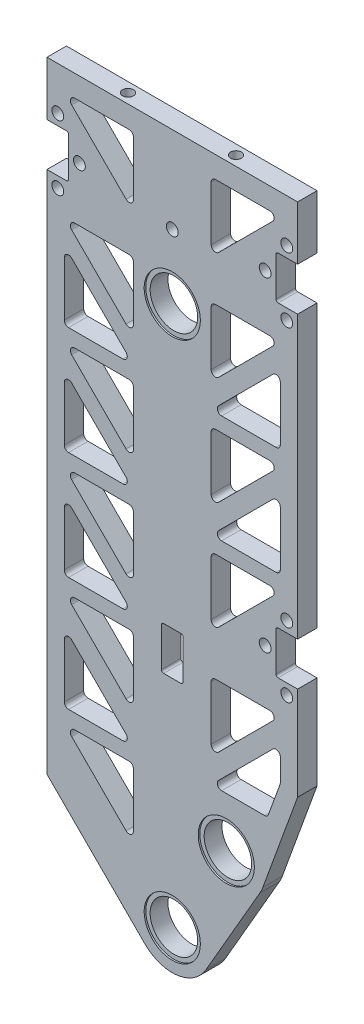
from build123d import *
from build123d.topology import SkipClean

# Parameters (mm, degrees)
SKETCH_1_R                   = 11
EXTRUDE_566_DEPTH            = 100
EXTRUDE_START                = -100
SKETCH_2_R                   = 11
EXTRUDE_875_DEPTH            = 100
EXTRUDE_2691_DEPTH           = 100
CUT_EXTRUDE_4148_DEPTH       = 534.010318849
CUT_EXTRUDE_4148_DEPTH_BACK  = 534.010318849
SKETCH_3_W                   = 90
SKETCH_3_H                   = 380
SKETCH_5_R                   = 2.5
EXTRUDE_4714_DEPTH           = 100
SKETCH_6_W                   = 191.177045066
SKETCH_6_H                   = 235.084722287
CUT_EXTRUDE_5028_DEPTH       = 84
SKETCH_7_R                   = 75
EXTRUDE_5316_DEPTH           = 5
CUT_EXTRUDE_6098_DEPTH       = 357.195171219
CUT_EXTRUDE_6098_DEPTH_BACK  = 357.195171219
FILLET_2_R                   = 2
MIRROR_START                 = 95
MIRROR_1_DEPTH               = 5
CUT_EXTRUDE_11151_DEPTH      = 357.195171219
CUT_EXTRUDE_11151_DEPTH_BACK = 357.195171219
SKETCH_12_W                  = 10
SKETCH_12_H                  = 20
FILLET_3_R                   = 1
CUT_EXTRUDE_START            = -5
CUT_EXTRUDE_12032_OUTLINE_R  = 5
CUT_EXTRUDE_12032_DEPTH      = 5
CUT_EXTRUDE_7_DEPTH          = 357.195171219
CUT_EXTRUDE_7_DEPTH_BACK     = 357.195171219
SKETCH_14_W                  = 10
SKETCH_14_H                  = 20
FILLET_4_R                   = 1
CUT_EXTRUDE_START_2          = -129
SKETCH_15_R                  = 11
CUT_EXTRUDE_8_DEPTH          = 129
SKETCH_16_R                  = 13
CUT_EXTRUDE_9_DEPTH          = 0.75
CUT_EXTRUDE_START_3          = -0.75
SKETCH_17_R                  = 13
CUT_EXTRUDE_10_DEPTH         = 0.75
SKETCH_18_R                  = 11
CUT_EXTRUDE_11_DEPTH         = 113
CUT_EXTRUDE_12_DEPTH         = 357.195171219
CUT_EXTRUDE_12_DEPTH_BACK    = 357.195171219
MOVE_FACE_1_BY               = 4
SKETCH_21_R                  = 2.5
CUT_EXTRUDE_13_DEPTH         = 17
CUT_EXTRUDE_15_DEPTH         = 326.338285481
CUT_EXTRUDE_15_DEPTH_BACK    = 326.338285481
SKETCH_23_R                  = 2.75
SKETCH_24_R                  = 13
CUT_EXTRUDE_16_DEPTH         = 0.75
SKETCH_25_R                  = 2.75
CUT_EXTRUDE_17_DEPTH         = 10


# Read off the part's stored shape, not the designer's step: 镜向1, 电机安装轴承孔
with BuildPart() as part:
    # 草图1 → Extrude 566 (new body)
    with BuildSketch(Plane.XY):
        with BuildLine():
            Line((-18, 500), (-18, 0))
            ThreePointArc((-18, 0), (0, -18), (18, 0))
            Line((18, 0), (18, 500))
            ThreePointArc((18, 500), (0, 518), (-18, 500))
        make_face()
        with Locations((0, 500)):
            Circle(SKETCH_1_R, mode=Mode.SUBTRACT)
        Circle(SKETCH_1_R, mode=Mode.SUBTRACT)
    extrude(amount=EXTRUDE_566_DEPTH)

    # 草图2 → Extrude 875 (add)
    with BuildSketch(Plane.XY.offset(100).offset(EXTRUDE_START)):
        with BuildLine():
            Line((18, 61.301270189), (25, 61.301270189))
            ThreePointArc((25, 61.301270189), (40.588457268, 52.301270189), (40.588457268, 34.301270189))
            Line((40.588457268, 34.301270189), (15.588457268, -9))
            ThreePointArc((15.588457268, -9), (-4.658742812, -17.386664873), (-18, 0))
            Line((-18, 0), (-18, 61.301270189))
            Line((-18, 61.301270189), (18, 61.301270189))
        make_face()
        with Locations((25, 43.301270189)):
            Circle(SKETCH_2_R, mode=Mode.SUBTRACT)
        Circle(SKETCH_2_R, mode=Mode.SUBTRACT)
    extrude(amount=EXTRUDE_875_DEPTH)

    # 草图10 → Extrude 2691 (add)
    with BuildSketch(Plane(origin=(0, 0, 0), x_dir=(-1, 0, 0), z_dir=(0, 0, -1))):
        with BuildLine():
            Line((-41.914467174, 37.144907609), (-58, 81.339545828))
            Line((-58, 81.339545828), (-58, 320))
            Line((-58, 320), (-18, 320))
            Line((-18, 320), (-18, 61.301270189))
            Line((-18, 61.301270189), (-25, 61.301270189))
            ThreePointArc((-25, 61.301270189), (-39.744736797, 53.625646044), (-41.914467174, 37.144907609))
        make_face()
        with BuildLine():
            Line((12.727922061, -12.727922061), (58, 32.544155877))
            Line((58, 32.544155877), (58, 320))
            Line((58, 320), (18, 320))
            Line((18, 320), (18, 0))
            ThreePointArc((18, 0), (16.629831585, -6.888301783), (12.727922061, -12.727922061))
        make_face()
    extrude(amount=-EXTRUDE_2691_DEPTH)

    # 草图3 → Cut-Extrude 4148 (cut, two sides: drawn at the far end of the back side and taken through both)
    with BuildSketch(Plane.ZY.offset(18).offset(-CUT_EXTRUDE_4148_DEPTH_BACK)):
        with Locations((50, 150)):
            Rectangle(SKETCH_3_W, SKETCH_3_H)
    extrude(amount=CUT_EXTRUDE_4148_DEPTH + CUT_EXTRUDE_4148_DEPTH_BACK, mode=Mode.SUBTRACT)

    # 草图5 → Extrude 4714 (add)
    with BuildSketch(Plane.XY.offset(100)):
        with Locations(Location((0, 250, 0), (0, 0, 90))):
            Circle(SKETCH_5_R)
    extrude(amount=-EXTRUDE_4714_DEPTH)

    # 草图6 → Cut-Extrude 5028 (cut)
    with BuildSketch(Plane(origin=(18, 0, 0), x_dir=(0, 0, -1), z_dir=(1, 0, 0))):
        with Locations((-50.962374235, 437.542361144)):
            Rectangle(SKETCH_6_W, SKETCH_6_H)
    extrude(amount=-CUT_EXTRUDE_5028_DEPTH, mode=Mode.SUBTRACT)

    # 草图7 → Extrude 5316 (add)
    with BuildSketch(Plane(origin=(0, 320, 0), x_dir=(1, 0, 0), z_dir=(0, 1, 0))):
        with Locations(Location((0, -50, 0), (0, 0, 320.654170234))):
            Circle(SKETCH_7_R)
    extrude(amount=EXTRUDE_5316_DEPTH)

    # 草图10<3> → Cut-Extrude 6098 (cut, two sides: drawn at the far end of the back side and taken through both)
    with BuildSketch(Plane(origin=(0, 0, 0), x_dir=(-1, 0, 0), z_dir=(0, 0, -1)).offset(-CUT_EXTRUDE_6098_DEPTH_BACK)):
        Polygon((50, 310), (18, 310), (18, 278), align=None)
        Polygon((-18, 278), (-18, 310), (-50, 310), align=None)
        Polygon((-18, 227.925713543), (-18, 259.925713543), (-50, 259.925713543), align=None)
        Polygon((50, 259.925713543), (18, 259.925713543), (18, 227.925713543), align=None)
        Polygon((50, 248.612005044), (50, 216.612005044), (18, 216.612005044), align=None)
        Polygon((-50, 248.612005044), (-50, 216.612005044), (-18, 216.612005044), align=None)
        Polygon((-18, 177.851427085), (-18, 209.851427085), (-50, 209.851427085), align=None)
        Polygon((50, 209.851427085), (18, 209.851427085), (18, 177.851427085), align=None)
        Polygon((50, 198.537718586), (50, 166.537718586), (18, 166.537718586), align=None)
        Polygon((-50, 198.537718586), (-50, 166.537718586), (-18, 166.537718586), align=None)
        Polygon((-50, 159.777140628), (-18, 127.777140628), (-18, 159.777140628), align=None)
        Polygon((18, 159.777140628), (18, 127.777140628), (50, 159.777140628), align=None)
        Polygon((-50, 109.702854171), (-18, 77.702854171), (-18, 109.702854171), align=None)
        Polygon((18, 109.702854171), (18, 77.702854171), (50, 109.702854171), align=None)
        Polygon((-50, 98.389145672), (-50, 82.750161674), (-44.045077173, 66.389145672), (-18, 66.389145672), align=None)
        Polygon((18, 56.800140588), (18, 24.800140588), (50, 56.800140588), align=None)
        Polygon((50, 95.560718547), (50, 63.560718547), (18, 63.560718547), align=None)
        Polygon((50, 116.463432129), (18, 116.463432129), (50, 148.463432129), align=None)
    extrude(amount=CUT_EXTRUDE_6098_DEPTH + CUT_EXTRUDE_6098_DEPTH_BACK, mode=Mode.SUBTRACT)

    # 圆角2
    fillet_2_edges = [part.edges().sort_by_distance(p)[0] for p in [
        (50, 109.702854171, 2.5),
        (18, 109.702854171, 2.5),
        (18, 77.702854171, 2.5),
        (-18, 159.777140628, 2.5),
        (-50, 159.777140628, 2.5),
        (-18, 127.777140628, 2.5),
        (50, 159.777140628, 2.5),
        (18, 159.777140628, 2.5),
        (18, 127.777140628, 2.5),
        (50, 166.537718586, 2.5),
        (50, 198.537718586, 2.5),
        (18, 166.537718586, 2.5),
        (-50, 63.560718547, 2.5),
        (-18, 63.560718547, 2.5),
        (-50, 95.560718547, 2.5),
        (-50, 56.800140588, 2.5),
        (-18, 24.800140588, 2.5),
        (-18, 56.800140588, 2.5),
        (50, 82.750161674, 2.5),
        (50, 98.389145672, 2.5),
        (18, 66.389145672, 2.5),
        (44.045077173, 66.389145672, 2.5),
        (-18, 109.702854171, 2.5),
        (-50, 109.702854171, 2.5),
        (-18, 77.702854171, 2.5),
        (50, 310, 2.5),
        (18, 310, 2.5),
        (18, 278, 2.5),
        (50, 259.925713543, 2.5),
        (18, 259.925713543, 2.5),
        (18, 227.925713543, 2.5),
        (-50, 248.612005044, 2.5),
        (-50, 216.612005044, 2.5),
        (-18, 216.612005044, 2.5),
        (-18, 259.925713543, 2.5),
        (-50, 259.925713543, 2.5),
        (-18, 227.925713543, 2.5),
        (50, 216.612005044, 2.5),
        (50, 248.612005044, 2.5),
        (18, 216.612005044, 2.5),
        (50, 209.851427085, 2.5),
        (18, 209.851427085, 2.5),
        (18, 177.851427085, 2.5),
        (-50, 198.537718586, 2.5),
        (-50, 166.537718586, 2.5),
        (-18, 166.537718586, 2.5),
        (-18, 209.851427085, 2.5),
        (-50, 209.851427085, 2.5),
        (-18, 177.851427085, 2.5),
        (-50, 148.463432129, 2.5),
        (-50, 116.463432129, 2.5),
        (-18, 116.463432129, 2.5),
        (-18, 310, 2.5),
        (-50, 310, 2.5),
        (-18, 278, 2.5),
    ]]
    fillet(fillet_2_edges, radius=FILLET_2_R)

    # 镜向1 outline → 镜向1 (add)
    with BuildSketch(Plane.XY.offset(MIRROR_START)):
        with BuildLine():
            ThreePointArc((-50, 143.635005004), (-48.765366865, 145.482764069), (-46.585786438, 145.049218567))
            Line((-46.585786438, 145.049218567), (-50, 148.463432129))
            Line((-50, 148.463432129), (-50, 143.635005004))
        make_face()
        with BuildLine():
            Line((-18, 116.463432129), (-21.414213562, 119.877645691))
            ThreePointArc((-21.414213562, 119.877645691), (-20.98066806, 117.698065264), (-22.828427125, 116.463432129))
            Line((-22.828427125, 116.463432129), (-18, 116.463432129))
        make_face()
        with BuildLine():
            ThreePointArc((-48, 116.463432129), (-49.414213562, 117.049218567), (-50, 118.463432129))
            Line((-50, 118.463432129), (-50, 116.463432129))
            Line((-50, 116.463432129), (-48, 116.463432129))
        make_face()
        with BuildLine():
            ThreePointArc((-20, 310), (-18.585786438, 309.414213562), (-18, 308))
            Line((-18, 308), (-18, 310))
            Line((-18, 310), (-20, 310))
        make_face()
        with BuildLine():
            Line((-18, 278), (-18, 282.828427125))
            ThreePointArc((-18, 282.828427125), (-19.234633135, 280.98066806), (-21.414213562, 281.414213562))
            Line((-21.414213562, 281.414213562), (-18, 278))
        make_face()
        with BuildLine():
            ThreePointArc((-46.585786438, 306.585786438), (-47.01933194, 308.765366865), (-45.171572875, 310))
            Line((-45.171572875, 310), (-50, 310))
            Line((-50, 310), (-46.585786438, 306.585786438))
        make_face()
        with BuildLine():
            ThreePointArc((-20, 259.925713543), (-18.585786438, 259.339927105), (-18, 257.925713543))
            Line((-18, 257.925713543), (-18, 259.925713543))
            Line((-18, 259.925713543), (-20, 259.925713543))
        make_face()
        with BuildLine():
            Line((-18, 227.925713543), (-18, 232.754140667))
            ThreePointArc((-18, 232.754140667), (-19.234633135, 230.906381602), (-21.414213562, 231.339927105))
            Line((-21.414213562, 231.339927105), (-18, 227.925713543))
        make_face()
        with BuildLine():
            ThreePointArc((-46.585786438, 256.51149998), (-47.01933194, 258.691080407), (-45.171572875, 259.925713543))
            Line((-45.171572875, 259.925713543), (-50, 259.925713543))
            Line((-50, 259.925713543), (-46.585786438, 256.51149998))
        make_face()
        with BuildLine():
            ThreePointArc((-50, 243.783577919), (-48.765366865, 245.631336984), (-46.585786438, 245.197791481))
            Line((-46.585786438, 245.197791481), (-50, 248.612005044))
            Line((-50, 248.612005044), (-50, 243.783577919))
        make_face()
        with BuildLine():
            Line((-18, 216.612005044), (-21.414213562, 220.026218606))
            ThreePointArc((-21.414213562, 220.026218606), (-20.98066806, 217.846638179), (-22.828427125, 216.612005044))
            Line((-22.828427125, 216.612005044), (-18, 216.612005044))
        make_face()
        with BuildLine():
            ThreePointArc((-48, 216.612005044), (-49.414213563, 217.197791481), (-50, 218.612005044))
            Line((-50, 218.612005044), (-50, 216.612005044))
            Line((-50, 216.612005044), (-48, 216.612005044))
        make_face()
        with BuildLine():
            ThreePointArc((-20, 209.851427085), (-18.585786438, 209.265640647), (-18, 207.851427085))
            Line((-18, 207.851427085), (-18, 209.851427085))
            Line((-18, 209.851427085), (-20, 209.851427085))
        make_face()
        with BuildLine():
            Line((-18, 177.851427085), (-18, 182.67985421))
            ThreePointArc((-18, 182.67985421), (-19.234633135, 180.832095145), (-21.414213562, 181.265640648))
            Line((-21.414213562, 181.265640648), (-18, 177.851427085))
        make_face()
        with BuildLine():
            ThreePointArc((-46.585786438, 206.437213523), (-47.01933194, 208.61679395), (-45.171572875, 209.851427085))
            Line((-45.171572875, 209.851427085), (-50, 209.851427085))
            Line((-50, 209.851427085), (-46.585786438, 206.437213523))
        make_face()
        with BuildLine():
            ThreePointArc((-50, 193.709291462), (-48.765366865, 195.557050527), (-46.585786438, 195.123505024))
            Line((-46.585786438, 195.123505024), (-50, 198.537718586))
            Line((-50, 198.537718586), (-50, 193.709291462))
        make_face()
        with BuildLine():
            Line((-18, 166.537718586), (-21.414213562, 169.951932149))
            ThreePointArc((-21.414213562, 169.951932149), (-20.98066806, 167.772351722), (-22.828427125, 166.537718586))
            Line((-22.828427125, 166.537718586), (-18, 166.537718586))
        make_face()
        with BuildLine():
            ThreePointArc((-48, 166.537718586), (-49.414213562, 167.123505024), (-50, 168.537718586))
            Line((-50, 168.537718586), (-50, 166.537718586))
            Line((-50, 166.537718586), (-48, 166.537718586))
        make_face()
        with BuildLine():
            ThreePointArc((-20, 159.777140628), (-18.585786438, 159.19135419), (-18, 157.777140628))
            Line((-18, 157.777140628), (-18, 159.777140628))
            Line((-18, 159.777140628), (-20, 159.777140628))
        make_face()
        with BuildLine():
            Line((-18, 127.777140628), (-18, 132.605567753))
            ThreePointArc((-18, 132.605567753), (-19.234633135, 130.757808688), (-21.414213562, 131.19135419))
            Line((-21.414213562, 131.19135419), (-18, 127.777140628))
        make_face()
        with BuildLine():
            ThreePointArc((-46.585786438, 156.362927066), (-47.01933194, 158.542507493), (-45.171572875, 159.777140628))
            Line((-45.171572875, 159.777140628), (-50, 159.777140628))
            Line((-50, 159.777140628), (-46.585786438, 156.362927066))
        make_face()
        with BuildLine():
            ThreePointArc((-20, 109.702854171), (-18.585786438, 109.117067733), (-18, 107.702854171))
            Line((-18, 107.702854171), (-18, 109.702854171))
            Line((-18, 109.702854171), (-20, 109.702854171))
        make_face()
        with BuildLine():
            Line((-18, 77.702854171), (-18, 82.531281295))
            ThreePointArc((-18, 82.531281295), (-19.234633135, 80.68352223), (-21.414213562, 81.117067733))
            Line((-21.414213562, 81.117067733), (-18, 77.702854171))
        make_face()
        with BuildLine():
            ThreePointArc((-46.585786438, 106.288640608), (-47.01933194, 108.468221035), (-45.171572875, 109.702854171))
            Line((-45.171572875, 109.702854171), (-50, 109.702854171))
            Line((-50, 109.702854171), (-46.585786438, 106.288640608))
        make_face()
        with BuildLine():
            ThreePointArc((-50, 90.732291422), (-48.765366865, 92.580050487), (-46.585786438, 92.146504984))
            Line((-46.585786438, 92.146504984), (-50, 95.560718547))
            Line((-50, 95.560718547), (-50, 90.732291422))
        make_face()
        with BuildLine():
            Line((-18, 63.560718547), (-21.414213562, 66.974932109))
            ThreePointArc((-21.414213562, 66.974932109), (-20.98066806, 64.795351682), (-22.828427125, 63.560718547))
            Line((-22.828427125, 63.560718547), (-18, 63.560718547))
        make_face()
        with BuildLine():
            ThreePointArc((-48, 63.560718547), (-49.414213562, 64.146504984), (-50, 65.560718547))
            Line((-50, 65.560718547), (-50, 63.560718547))
            Line((-50, 63.560718547), (-48, 63.560718547))
        make_face()
        with BuildLine():
            ThreePointArc((-46.585786438, 53.385927026), (-47.01933194, 55.565507453), (-45.171572875, 56.800140588))
            Line((-45.171572875, 56.800140588), (-50, 56.800140588))
            Line((-50, 56.800140588), (-46.585786438, 53.385927026))
        make_face()
        with BuildLine():
            Line((-18, 56.800140588), (-20, 56.800140588))
            ThreePointArc((-20, 56.800140588), (-18.585786437, 56.214354151), (-18, 54.800140588))
            Line((-18, 54.800140588), (-18, 56.800140588))
        make_face()
        with BuildLine():
            ThreePointArc((-18, 29.628567713), (-19.234633135, 27.780808648), (-21.414213562, 28.214354151))
            Line((-21.414213562, 28.214354151), (-18, 24.800140588))
            Line((-18, 24.800140588), (-18, 29.628567713))
        make_face()
        with BuildLine():
            ThreePointArc((46.585786438, 94.974932109), (48.765366865, 95.408477612), (50, 93.560718547))
            Line((50, 93.560718547), (50, 98.389145672))
            Line((50, 98.389145672), (46.585786438, 94.974932109))
        make_face()
        with BuildLine():
            Line((50, 82.750161674), (50, 83.102815635))
            ThreePointArc((50, 83.102815635), (49.969615506, 82.75551928), (49.879385242, 82.418775349))
            Line((49.879385242, 82.418775349), (50, 82.750161674))
        make_face()
        with BuildLine():
            ThreePointArc((22.828427125, 66.389145672), (20.98066806, 67.623778807), (21.414213562, 69.803359234))
            Line((21.414213562, 69.803359234), (18, 66.389145672))
            Line((18, 66.389145672), (22.828427125, 66.389145672))
        make_face()
        with BuildLine():
            Line((44.045077173, 66.389145672), (44.524047338, 67.705105385))
            ThreePointArc((44.524047338, 67.705105385), (43.791814969, 66.750841583), (42.644662096, 66.389145672))
            Line((42.644662096, 66.389145672), (44.045077173, 66.389145672))
        make_face()
        with BuildLine():
            Line((18, 109.702854171), (18, 107.702854171))
            ThreePointArc((18, 107.702854171), (18.585786438, 109.117067733), (20, 109.702854171))
            Line((20, 109.702854171), (18, 109.702854171))
        make_face()
        with BuildLine():
            ThreePointArc((21.414213562, 81.117067733), (19.234633135, 80.68352223), (18, 82.531281295))
            Line((18, 82.531281295), (18, 77.702854171))
            Line((18, 77.702854171), (21.414213562, 81.117067733))
        make_face()
        with BuildLine():
            Line((50, 109.702854171), (45.171572875, 109.702854171))
            ThreePointArc((45.171572875, 109.702854171), (47.01933194, 108.468221035), (46.585786438, 106.288640608))
            Line((46.585786438, 106.288640608), (50, 109.702854171))
        make_face()
        with BuildLine():
            Line((18, 159.777140628), (18, 157.777140628))
            ThreePointArc((18, 157.777140628), (18.585786438, 159.19135419), (20, 159.777140628))
            Line((20, 159.777140628), (18, 159.777140628))
        make_face()
        with BuildLine():
            ThreePointArc((21.414213562, 131.19135419), (19.234633135, 130.757808688), (18, 132.605567753))
            Line((18, 132.605567753), (18, 127.777140628))
            Line((18, 127.777140628), (21.414213562, 131.19135419))
        make_face()
        with BuildLine():
            Line((50, 159.777140628), (45.171572875, 159.777140628))
            ThreePointArc((45.171572875, 159.777140628), (47.01933194, 158.542507493), (46.585786438, 156.362927066))
            Line((46.585786438, 156.362927066), (50, 159.777140628))
        make_face()
        with BuildLine():
            ThreePointArc((50, 168.537718586), (49.414213562, 167.123505024), (48, 166.537718586))
            Line((48, 166.537718586), (50, 166.537718586))
            Line((50, 166.537718586), (50, 168.537718586))
        make_face()
        with BuildLine():
            Line((18, 166.537718586), (22.828427125, 166.537718586))
            ThreePointArc((22.828427125, 166.537718586), (20.98066806, 167.772351722), (21.414213562, 169.951932149))
            Line((21.414213562, 169.951932149), (18, 166.537718586))
        make_face()
        with BuildLine():
            ThreePointArc((46.585786438, 195.123505024), (48.765366865, 195.557050527), (50, 193.709291462))
            Line((50, 193.709291462), (50, 198.537718586))
            Line((50, 198.537718586), (46.585786438, 195.123505024))
        make_face()
        with BuildLine():
            Line((18, 177.851427085), (21.414213562, 181.265640648))
            ThreePointArc((21.414213562, 181.265640648), (19.234633135, 180.832095145), (18, 182.67985421))
            Line((18, 182.67985421), (18, 177.851427085))
        make_face()
        with BuildLine():
            ThreePointArc((45.171572875, 209.851427085), (47.01933194, 208.61679395), (46.585786438, 206.437213523))
            Line((46.585786438, 206.437213523), (50, 209.851427085))
            Line((50, 209.851427085), (45.171572875, 209.851427085))
        make_face()
        with BuildLine():
            Line((18, 209.851427085), (18, 207.851427085))
            ThreePointArc((18, 207.851427085), (18.585786438, 209.265640647), (20, 209.851427085))
            Line((20, 209.851427085), (18, 209.851427085))
        make_face()
        with BuildLine():
            ThreePointArc((50, 218.612005044), (49.414213563, 217.197791481), (48, 216.612005044))
            Line((48, 216.612005044), (50, 216.612005044))
            Line((50, 216.612005044), (50, 218.612005044))
        make_face()
        with BuildLine():
            Line((18, 216.612005044), (22.828427125, 216.612005044))
            ThreePointArc((22.828427125, 216.612005044), (20.98066806, 217.846638179), (21.414213562, 220.026218606))
            Line((21.414213562, 220.026218606), (18, 216.612005044))
        make_face()
        with BuildLine():
            ThreePointArc((46.585786438, 245.197791481), (48.765366865, 245.631336984), (50, 243.783577919))
            Line((50, 243.783577919), (50, 248.612005044))
            Line((50, 248.612005044), (46.585786438, 245.197791481))
        make_face()
        with BuildLine():
            Line((18, 227.925713543), (21.414213562, 231.339927105))
            ThreePointArc((21.414213562, 231.339927105), (19.234633135, 230.906381602), (18, 232.754140667))
            Line((18, 232.754140667), (18, 227.925713543))
        make_face()
        with BuildLine():
            ThreePointArc((45.171572875, 259.925713543), (47.01933194, 258.691080407), (46.585786438, 256.51149998))
            Line((46.585786438, 256.51149998), (50, 259.925713543))
            Line((50, 259.925713543), (45.171572875, 259.925713543))
        make_face()
        with BuildLine():
            Line((18, 259.925713543), (18, 257.925713543))
            ThreePointArc((18, 257.925713543), (18.585786438, 259.339927105), (20, 259.925713543))
            Line((20, 259.925713543), (18, 259.925713543))
        make_face()
        with BuildLine():
            Line((18, 278), (21.414213562, 281.414213562))
            ThreePointArc((21.414213562, 281.414213562), (19.234633135, 280.98066806), (18, 282.828427125))
            Line((18, 282.828427125), (18, 278))
        make_face()
        with BuildLine():
            ThreePointArc((45.171572875, 310), (47.01933194, 308.765366865), (46.585786438, 306.585786438))
            Line((46.585786438, 306.585786438), (50, 310))
            Line((50, 310), (45.171572875, 310))
        make_face()
        with BuildLine():
            Line((18, 310), (18, 308))
            ThreePointArc((18, 308), (18.585786438, 309.414213562), (20, 310))
            Line((20, 310), (18, 310))
        make_face()
    extrude(amount=MIRROR_1_DEPTH)

    # 草图12 → Cut-Extrude 11151 (cut, two sides: drawn at the far end of the back side and taken through both)
    with BuildSketch(Plane(origin=(0, 0, 0), x_dir=(-1, 0, 0), z_dir=(0, 0, -1)).offset(-CUT_EXTRUDE_11151_DEPTH_BACK)):
        with Locations((-53, 285)):
            Rectangle(SKETCH_12_W, SKETCH_12_H)
        with Locations((-53, 134.702854171)):
            Rectangle(SKETCH_12_W, SKETCH_12_H)
        with Locations((53, 285)):
            Rectangle(SKETCH_12_W, SKETCH_12_H)
    extrude(amount=CUT_EXTRUDE_11151_DEPTH + CUT_EXTRUDE_11151_DEPTH_BACK, mode=Mode.SUBTRACT)

    # 圆角3
    fillet_3_edges = [part.edges().sort_by_distance(p)[0] for p in [
        (-48, 275, 2.5),
        (-48, 295, 2.5),
        (-48, 275, 97.5),
        (-48, 295, 97.5),
        (48, 144.702854171, 2.5),
        (48, 124.702854171, 2.5),
        (48, 144.702854171, 97.5),
        (48, 124.702854171, 97.5),
        (48, 295, 2.5),
        (48, 275, 2.5),
        (48, 295, 97.5),
        (48, 275, 97.5),
    ]]
    fillet(fillet_3_edges, radius=FILLET_3_R)

    # Cut-Extrude 12032 outline → Cut-Extrude 12032 (cut)
    with BuildSketch(Plane.XY.offset(5).offset(CUT_EXTRUDE_START)):
        with Locations((0, 250)):
            Circle(CUT_EXTRUDE_12032_OUTLINE_R)
    cut_extrude_12032 = extrude(amount=CUT_EXTRUDE_12032_DEPTH, mode=Mode.SUBTRACT)

    # 镜向2: Cut-Extrude 12032 across plane
    add(cut_extrude_12032.mirror(Plane(origin=(0, 0, 50), x_dir=(1, 0, 0), z_dir=(0, 0, -1))), mode=Mode.SUBTRACT)

    # 草图14 → 切除-拉伸7 (cut, two sides: drawn at the far end of the back side and taken through both)
    with BuildSketch(Plane(origin=(0, 0, 0), x_dir=(-1, 0, 0), z_dir=(0, 0, -1)).offset(-CUT_EXTRUDE_7_DEPTH_BACK)):
        with Locations((0, 110)):
            Rectangle(SKETCH_14_W, SKETCH_14_H)
    extrude(amount=CUT_EXTRUDE_7_DEPTH + CUT_EXTRUDE_7_DEPTH_BACK, mode=Mode.SUBTRACT)

    # 圆角4
    fillet_4_edges = [part.edges().sort_by_distance(p)[0] for p in [
        (5, 100, 2.5),
        (5, 120, 2.5),
        (-5, 120, 2.5),
        (-5, 100, 2.5),
        (5, 100, 97.5),
        (5, 120, 97.5),
        (-5, 120, 97.5),
        (-5, 100, 97.5),
    ]]
    fillet(fillet_4_edges, radius=FILLET_4_R)

    # 草图15 → 切除-拉伸8 (cut)
    with BuildSketch(Plane.XY.offset(100).offset(CUT_EXTRUDE_START_2)):
        with Locations((25, 43.301270189)):
            Circle(SKETCH_15_R)
    extrude(amount=CUT_EXTRUDE_8_DEPTH, mode=Mode.SUBTRACT)

    # 草图16 → 切除-拉伸9 (cut)
    with BuildSketch(Plane.XY.offset(100)):
        with Locations((25, 43.301270189)):
            Circle(SKETCH_16_R)
        Circle(SKETCH_16_R)
    extrude(amount=-CUT_EXTRUDE_9_DEPTH, mode=Mode.SUBTRACT)

    # 草图17 → 切除-拉伸10 (cut)
    with BuildSketch(Plane(origin=(0, 0, 0), x_dir=(-1, 0, 0), z_dir=(0, 0, -1)).offset(CUT_EXTRUDE_START_3)):
        with Locations(Location((0, 0, 0), (0, 0, 180))):
            Circle(SKETCH_17_R)
        with Locations(Location((-25, 43.301270189, 0), (0, 0, 180))):
            Circle(SKETCH_17_R)
    extrude(amount=CUT_EXTRUDE_10_DEPTH, mode=Mode.SUBTRACT)

    # 草图18 → 切除-拉伸11 (cut)
    with BuildSketch(Plane.XY.offset(100)):
        with Locations((0, 250)):
            Circle(SKETCH_18_R)
    extrude(amount=-CUT_EXTRUDE_11_DEPTH, mode=Mode.SUBTRACT)

    # 草图20 → 切除-拉伸12 (cut, two sides: drawn at the far end of the back side and taken through both)
    with BuildSketch(Plane(origin=(0, 0, 0), x_dir=(0, 0, -1), z_dir=(1, 0, 0)).offset(-CUT_EXTRUDE_12_DEPTH_BACK)):
        Polygon((25, 325), (-125, 325), (-125, 320), (-25.33563281, 320), (-25.33563281, -69.714061667), (25, -69.714061667), align=None)
    extrude(amount=CUT_EXTRUDE_12_DEPTH + CUT_EXTRUDE_12_DEPTH_BACK, mode=Mode.SUBTRACT)

    # Move Face 1: a face moved outward by 4.0
    extrude(part.faces().sort_by_distance((-0.855426636, 163.028428235, 95))[0], amount=MOVE_FACE_1_BY, dir=(0, 0, -1))

    # 草图21 → 切除-拉伸13 (cut)
    with SkipClean():  # the faces are left unmerged after this step: merging them gives an invalid solid
        with BuildSketch(Plane(origin=(0, 320, 0), x_dir=(1, 0, 0), z_dir=(0, 1, 0))):
            with Locations(Location((-25, -95.5, 0), (0, 0, 270))):
                Circle(SKETCH_21_R)
            with Locations(Location((25, -95.5, 0), (0, 0, 270))):
                Circle(SKETCH_21_R)
        extrude(amount=-CUT_EXTRUDE_13_DEPTH, mode=Mode.SUBTRACT)

    # 草图23 → 切除-拉伸15 (cut, two sides: drawn at the far end of the back side and taken through both)
    with SkipClean():  # the faces are left unmerged after this step: merging them gives an invalid solid
        with BuildSketch(Plane.XY.offset(100).offset(-CUT_EXTRUDE_15_DEPTH_BACK)):
            with Locations((53, 300)):
                Circle(SKETCH_23_R)
            with Locations((43, 285)):
                Circle(SKETCH_23_R)
            with Locations((53, 270)):
                Circle(SKETCH_23_R)
            with Locations((-53, 300)):
                Circle(SKETCH_23_R)
            with Locations((-43, 285)):
                Circle(SKETCH_23_R)
            with Locations((-53, 270)):
                Circle(SKETCH_23_R)
            with Locations((53, 149.702854171)):
                Circle(SKETCH_23_R)
            with Locations((43, 134.702854171)):
                Circle(SKETCH_23_R)
            with Locations((53, 119.702854171)):
                Circle(SKETCH_23_R)
        extrude(amount=CUT_EXTRUDE_15_DEPTH + CUT_EXTRUDE_15_DEPTH_BACK, mode=Mode.SUBTRACT)

    # 草图24 → 切除-拉伸16 (cut)
    with SkipClean():  # the faces are left unmerged after this step: merging them gives an invalid solid
        with BuildSketch(Plane.XY.offset(100)):
            with Locations((0, 250)):
                Circle(SKETCH_24_R)
        extrude(amount=-CUT_EXTRUDE_16_DEPTH, mode=Mode.SUBTRACT)

    # 草图25 → 切除-拉伸17 (cut)
    with SkipClean():  # the faces are left unmerged after this step: merging them gives an invalid solid
        with BuildSketch(Plane.XY.offset(100)):
            with Locations((0, 280)):
                Circle(SKETCH_25_R)
        extrude(amount=-CUT_EXTRUDE_17_DEPTH, mode=Mode.SUBTRACT)


solid = part.part
